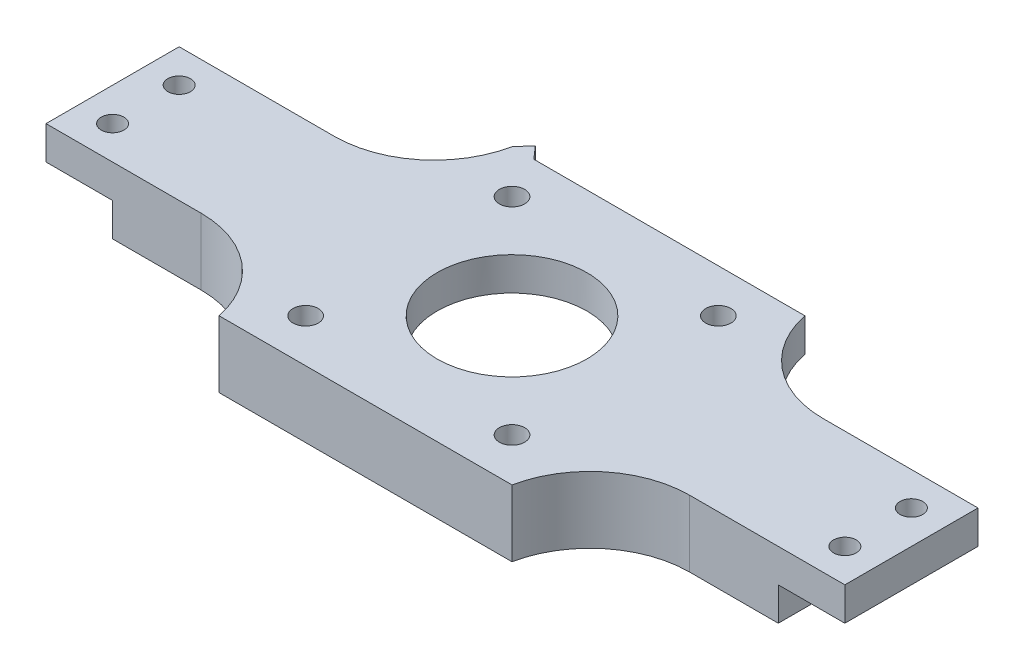
from build123d import *

# Parameters (mm, degrees)
AUFSATZ_LINEAR_AUSTRAGEN1_DEPTH      = 10
SKIZZE6_R                            = 1.9
SKIZZE6_R_2                          = 11.25
SCHNITT_LINEAR_AUSTRAGEN4_DEPTH      = 67.632124385
SKIZZE7_W                            = 20.880821379
SKIZZE7_H                            = 5
SCHNITT_LINEAR_AUSTRAGEN5_DEPTH      = 87.970339772
VERRUNDUNG3_R                        = 15
SCHNITT_LINEAR_AUSTRAGEN6_DEPTH      = 69.73136111
SCHNITT_LINEAR_AUSTRAGEN6_DEPTH_BACK = 69.73136111
SKIZZE8_W                            = 10
SKIZZE8_H                            = 5
SKIZZE9_R                            = 1.7
SCHNITT_LINEAR_AUSTRAGEN7_DEPTH      = 10
AUFSATZ_LINEAR_AUSTRAGEN2_DEPTH      = 5
FASE1_DEPTH                          = 5
VERRUNDUNG6_R                        = 10


with BuildPart() as part:
    # Skizze1 → Aufsatz-Linear austragen1 (new body)
    with BuildSketch(Plane(origin=(0, 0, 0), x_dir=(1, 0, 0), z_dir=(0, 1, 0))):
        Polygon((-60, -4.8), (-22, -4.8), (-22, -16.8), (22, -16.8), (22, -4.8), (60, -4.8), (60, 15.2), (22, 15.2), (22, 27.2), (0, 27.2), (-22, 27.2), (-22, 15.2), (-60, 15.2), align=None)
    extrude(amount=AUFSATZ_LINEAR_AUSTRAGEN1_DEPTH)

    # Skizze6 → Schnitt-Linear austragen4 (cut, through all)
    with BuildSketch(Plane(origin=(0, 10, 0), x_dir=(1, 0, 0), z_dir=(0, 1, 0))):
        with Locations(Location((15.5, 20.7, 0), (0, 0, 270))):
            Circle(SKIZZE6_R)
        with Locations(Location((15.5, -10.3, 0), (0, 0, 270))):
            Circle(SKIZZE6_R)
        with Locations(Location((-15.5, -10.3, 0), (0, 0, 270))):
            Circle(SKIZZE6_R)
        with Locations(Location((-15.5, 20.7, 0), (0, 0, 270))):
            Circle(SKIZZE6_R)
        with Locations(Location((0, 5.2, 0), (0, 0, 270))):
            Circle(SKIZZE6_R_2)
    extrude(amount=-SCHNITT_LINEAR_AUSTRAGEN4_DEPTH, mode=Mode.SUBTRACT)

    # Skizze7 → Schnitt-Linear austragen5 (cut, through all)
    with BuildSketch(Plane.ZY.offset(22)):
        with Locations((-25.64041069, 2.5)):
            Rectangle(SKIZZE7_W, SKIZZE7_H)
    extrude(amount=-SCHNITT_LINEAR_AUSTRAGEN5_DEPTH, mode=Mode.SUBTRACT)

    # Verrundung3
    # the kernel refuses this fillet: 15 mm, written as the material it adds along each edge
    with BuildSketch(Plane(origin=(-22, 5, -15.2), x_dir=(0, 0, -1), z_dir=(0, 1, 0))) as verrundung3_piece_1:
        with BuildLine():
            CenterArc((15, 14.696938457), VERRUNDUNG3_R, 180, 78.463040967)
            Line((0, 14.696938457), (-0.3, 14.696938457))
            Line((-0.3, 14.696938457), (-0.3, 0))
            Line((-0.3, 0), (0, -0.3))
            ThreePointArc((0, -0.3), (6, -0.3), (11.94, -0.293938769))
            Line((11.94, -0.293938769), (12, 0))
        make_face()
    extrude(amount=5)
    with BuildSketch(Plane(origin=(-22, 0, 4.8), x_dir=(-1, 0, 0), z_dir=(0, 1, 0))) as verrundung3_piece_2:
        with BuildLine():
            CenterArc((14.696938457, 15), VERRUNDUNG3_R, 191.536959033, 78.463040967)
            Line((0, 12), (-0.293938769, 11.94))
            ThreePointArc((-0.293938769, 11.94), (-0.3, 6), (-0.3, 0))
            Line((-0.3, 0), (0, -0.3))
            Line((0, -0.3), (14.696938457, -0.3))
            Line((14.696938457, -0.3), (14.696938457, 0))
        make_face()
    extrude(amount=10)
    with BuildSketch(Plane(origin=(22, 0, 4.8), x_dir=(1, 0, 0), z_dir=(0, 1, 0))) as verrundung3_piece_3:
        with BuildLine():
            CenterArc((14.696938457, -15), VERRUNDUNG3_R, 90, 78.463040967)
            Line((0, -12), (-0.293938769, -11.94))
            ThreePointArc((-0.293938769, -11.94), (-0.3, -6), (-0.3, 0))
            Line((-0.3, 0), (0, 0.3))
            Line((0, 0.3), (14.696938457, 0.3))
            Line((14.696938457, 0.3), (14.696938457, 0))
        make_face()
    extrude(amount=10)
    with BuildSketch(Plane(origin=(22, 5, -15.2), x_dir=(1, 0, 0), z_dir=(0, 1, 0))) as verrundung3_piece_4:
        with BuildLine():
            CenterArc((14.696938457, 15), VERRUNDUNG3_R, 191.536959033, 78.463040967)
            Line((0, 12), (-0.293938769, 11.94))
            ThreePointArc((-0.293938769, 11.94), (-0.3, 6), (-0.3, 0))
            Line((-0.3, 0), (0, -0.3))
            Line((0, -0.3), (14.696938457, -0.3))
            Line((14.696938457, -0.3), (14.696938457, 0))
        make_face()
    extrude(amount=5)

    # Skizze8 → Schnitt-Linear austragen6 (cut, two sides: drawn at the far end of the back side and taken through both)
    with BuildSketch(Plane(origin=(0, 0, -15.2), x_dir=(-1, 0, 0), z_dir=(0, 0, -1)).offset(-SCHNITT_LINEAR_AUSTRAGEN6_DEPTH_BACK)):
        with Locations((-55, 2.5)):
            Rectangle(SKIZZE8_W, SKIZZE8_H)
        with Locations((55, 2.5)):
            Rectangle(SKIZZE8_W, SKIZZE8_H)
    extrude(amount=SCHNITT_LINEAR_AUSTRAGEN6_DEPTH + SCHNITT_LINEAR_AUSTRAGEN6_DEPTH_BACK, mode=Mode.SUBTRACT)

    # Skizze9 → Schnitt-Linear austragen7 (cut)
    with BuildSketch(Plane.XZ.offset(-5)):
        with Locations(Location((-55, -0.2, 0), (0, 0, 270))):
            Circle(SKIZZE9_R)
        with Locations(Location((-55, -10.2, 0), (0, 0, 90))):
            Circle(SKIZZE9_R)
        with Locations(Location((55, -10.2, 0), (0, 0, 270))):
            Circle(SKIZZE9_R)
        with Locations(Location((55, -0.2, 0), (0, 0, 90))):
            Circle(SKIZZE9_R)
    extrude(amount=-SCHNITT_LINEAR_AUSTRAGEN7_DEPTH, mode=Mode.SUBTRACT)

    # Skizze10 → Aufsatz-Linear austragen2 (add)
    with BuildSketch(Plane(origin=(0, 10, 0), x_dir=(1, 0, 0), z_dir=(0, 1, 0))):
        Polygon((-22, 27.2), (-20.360366379, 29.068218634), (-18.720732758, 27.2), align=None)
    extrude(amount=-AUFSATZ_LINEAR_AUSTRAGEN2_DEPTH)

    # Fase1: read off the stored shape, not the designer's step
    # Fase1 outline → Fase1 (cut)
    with BuildSketch(Plane(origin=(0, 0, 0), x_dir=(1, 0, 0), z_dir=(0, 1, 0))):
        with BuildLine():
            Line((-5.153882032, 15.2), (-33.153882032, 15.2))
            Line((-33.153882032, 15.2), (-8.71856035, -1.90979644))
            ThreePointArc((-8.71856035, -1.90979644), (-11.013512063, 7.494570119), (-5.153882032, 15.2))
        make_face()
        with BuildLine():
            ThreePointArc((5.153882032, 15.2), (11.013512063, 7.494570119), (8.71856035, -1.90979644))
            Line((8.71856035, -1.90979644), (33.153882032, 15.2))
            Line((33.153882032, 15.2), (5.153882032, 15.2))
        make_face()
    extrude(amount=FASE1_DEPTH, mode=Mode.SUBTRACT)

    # Verrundung6
    verrundung6_edges = [part.edges().sort_by_distance(p)[0] for p in [
        (8.71856035, 2.5, 1.90979644),
        (-8.71856035, 2.5, 1.90979644),
        (-33.153882032, 2.5, -15.2),
        (33.153882032, 2.5, -15.2),
    ]]
    fillet(verrundung6_edges, radius=VERRUNDUNG6_R)


solid = part.part
